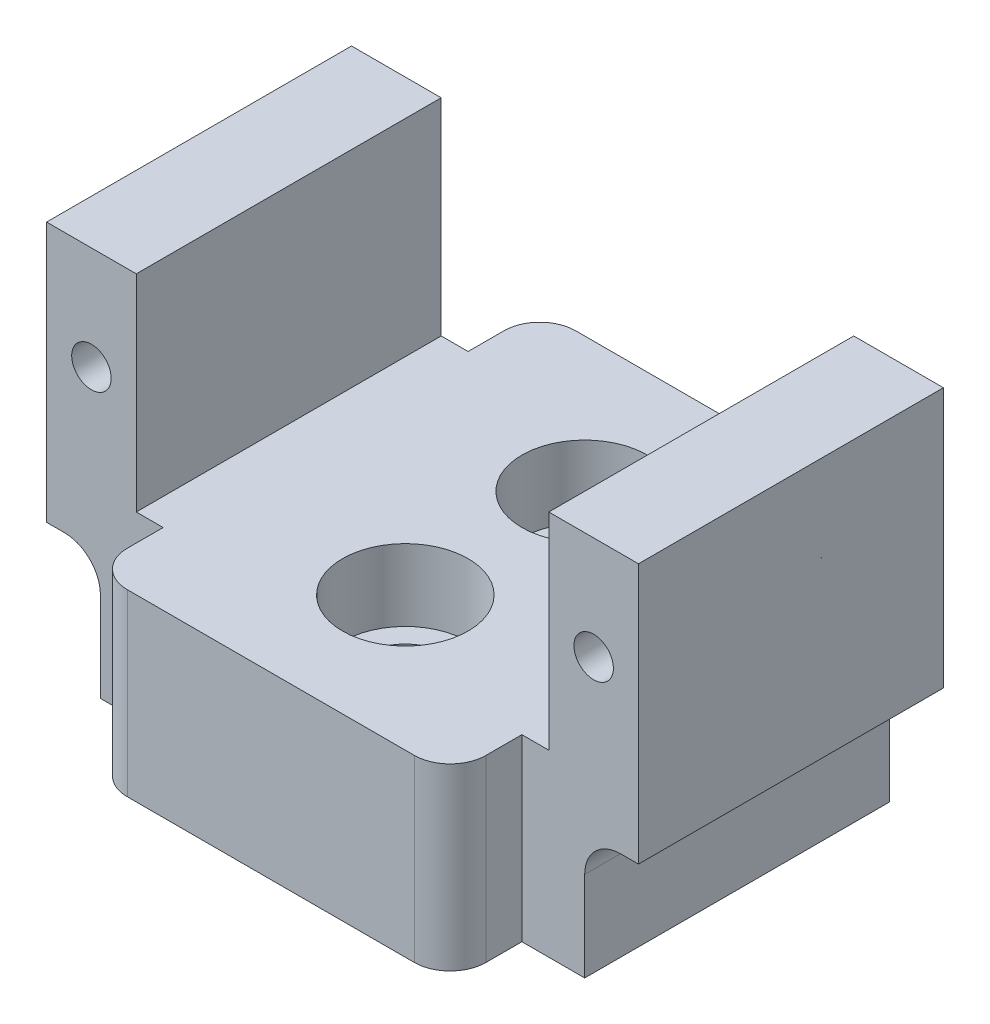
from build123d import *

# Parameters (mm, degrees)
SALIENTE_EXTRUIR1_DEPTH = 17
CROQUIS4_R              = 2.5
CORTAR_EXTRUIR2_DEPTH   = 5
CROQUIS5_W              = 27
CROQUIS5_H              = 17
CROQUIS5_R              = 2.5
SALIENTE_EXTRUIR4_DEPTH = 7
REDONDEO2_R             = 2
CROQUIS6_R              = 3.5
CORTAR_EXTRUIR3_DEPTH   = 1
CROQUIS9_R              = 3.5
SALIENTE_EXTRUIR7_DEPTH = 10
CROQUIS10_W             = 20
CROQUIS10_H             = 25
SALIENTE_EXTRUIR8_DEPTH = 10
CROQUIS11_R             = 2.3
CORTAR_EXTRUIR6_DEPTH   = 10
CROQUIS12_R             = 3.5
CORTAR_EXTRUIR7_DEPTH   = 4
REDONDEO3_R             = 2
CROQUIS8_R              = 1.1
CORTAR_EXTRUIR8_DEPTH   = 41.770700264


with BuildPart() as part:
    # Croquis2 → Saliente-Extruir1 (new body)
    with BuildSketch(Plane.XY):
        Polygon((0, 0), (0, 11.5), (5, 11.5), (5, 0), (28, 0), (28, 11.5), (33, 11.5), (33, 0), (33, -3), (0, -3), align=None)
    extrude(amount=SALIENTE_EXTRUIR1_DEPTH)

    # Croquis4 → Cortar-Extruir2 (cut)
    with BuildSketch(Plane(origin=(0, 0, 0), x_dir=(1, 0, 0), z_dir=(0, 1, 0))):
        with Locations((9, -8.5)):
            Circle(CROQUIS4_R)
        with Locations((24, -8.5)):
            Circle(CROQUIS4_R)
    extrude(amount=-CORTAR_EXTRUIR2_DEPTH, mode=Mode.SUBTRACT)

    # Croquis5 → Saliente-Extruir4 (add)
    with BuildSketch(Plane.XZ.offset(3)):
        with Locations((16.5, 8.5)):
            Rectangle(CROQUIS5_W, CROQUIS5_H)
        with Locations((9, 8.5)):
            Circle(CROQUIS5_R, mode=Mode.SUBTRACT)
        with Locations((24, 8.5)):
            Circle(CROQUIS5_R, mode=Mode.SUBTRACT)
    extrude(amount=SALIENTE_EXTRUIR4_DEPTH)

    # Redondeo2
    redondeo2_edges = [part.edges().sort_by_distance(p)[0] for p in [
        (3, -3, 8.5),
        (30, -3, 8.5),
    ]]
    fillet(redondeo2_edges, radius=REDONDEO2_R)

    # Croquis6 → Cortar-Extruir3 (cut)
    with BuildSketch(Plane(origin=(0, 0, 0), x_dir=(1, 0, 0), z_dir=(0, 1, 0))):
        with Locations((9, -8.5)):
            Circle(CROQUIS6_R)
        with Locations((24, -8.5)):
            Circle(CROQUIS6_R)
    extrude(amount=-CORTAR_EXTRUIR3_DEPTH, mode=Mode.SUBTRACT)

    # Croquis9 → Saliente-Extruir7 (add)
    with BuildSketch(Plane(origin=(0, 0, 0), x_dir=(1, 0, 0), z_dir=(0, 1, 0))):
        with Locations((9, -8.5)):
            Circle(CROQUIS9_R)
        with Locations((24, -8.5)):
            Circle(CROQUIS9_R)
    extrude(amount=-SALIENTE_EXTRUIR7_DEPTH)

    # Croquis10 → Saliente-Extruir8 (add)
    with BuildSketch(Plane.XZ.offset(10)):
        with Locations((16.5, 8.5)):
            Rectangle(CROQUIS10_W, CROQUIS10_H)
    extrude(amount=-SALIENTE_EXTRUIR8_DEPTH)

    # Croquis11 → Cortar-Extruir6 (cut)
    with BuildSketch(Plane.XZ.offset(10)):
        with Locations((16.5, 13.5)):
            Circle(CROQUIS11_R)
        with Locations((16.5, 3.5)):
            Circle(CROQUIS11_R)
    extrude(amount=-CORTAR_EXTRUIR6_DEPTH, mode=Mode.SUBTRACT)

    # Croquis12 → Cortar-Extruir7 (cut)
    with BuildSketch(Plane(origin=(0, 0, 0), x_dir=(1, 0, 0), z_dir=(0, 1, 0))):
        with Locations((16.5, -3.5)):
            Circle(CROQUIS12_R)
        with Locations((16.5, -13.5)):
            Circle(CROQUIS12_R)
    extrude(amount=-CORTAR_EXTRUIR7_DEPTH, mode=Mode.SUBTRACT)

    # Redondeo3
    redondeo3_edges = [part.edges().sort_by_distance(p)[0] for p in [
        (26.5, -5, -4),
        (6.5, -5, -4),
        (6.5, -5, 21),
        (26.5, -5, 21),
    ]]
    fillet(redondeo3_edges, radius=REDONDEO3_R)

    # Croquis8 → Cortar-Extruir8 (cut, through all)
    with BuildSketch(Plane.XY.offset(17)):
        with Locations((2.5, 5.75)):
            Circle(CROQUIS8_R)
        with Locations((30.5, 5.75)):
            Circle(CROQUIS8_R)
    extrude(amount=-CORTAR_EXTRUIR8_DEPTH, mode=Mode.SUBTRACT)


solid = part.part
